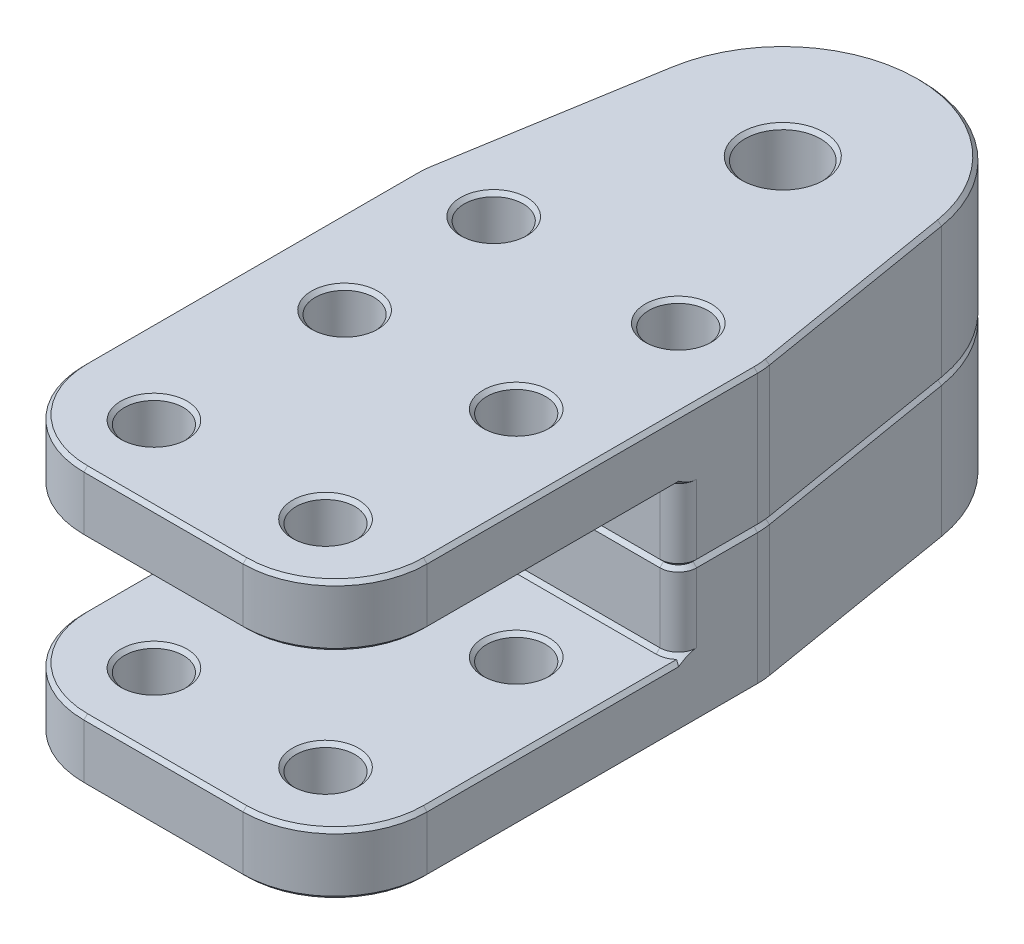
from build123d import *

# Parameters (mm, degrees)
BOSS_EXTRUDE1_DEPTH = 37.29
SKETCH2_R           = 4.1
SKETCH2_R_2         = 3.2
CUT_EXTRUDE1_DEPTH  = 61.336921532
FILLET1_R           = 10
FILLET2_R           = 2
CHAMFER1_SIZE       = 0.4
CHAMFER2_SIZE       = 0.4
CHAMFER3_SIZE       = 0.4


with BuildPart() as part:
    # Sketch1 → Boss-Extrude1 (new body)
    with BuildSketch(Plane.YZ):
        Polygon((-8.33, 0), (-8.33, 37.29), (-15, 37.29), (-15, -45), (0, -45), (0, 0), align=None)
    extrude(amount=-BOSS_EXTRUDE1_DEPTH)

    # Sketch2 → Cut-Extrude1 (cut, through all)
    with BuildSketch(Plane.XZ.offset(15)):
        with BuildLine():
            ThreePointArc((-3.848361358, -32.461602101), (-8.947681595, -41.443863673), (-18.645, -45))
            Line((-18.645, -45), (0, -45))
            Line((0, -45), (0, -8.617279713))
            ThreePointArc((0, -8.617279713), (-0.029256693, -9.32676563), (-0.116828114, -10.031433969))
            Line((-0.116828114, -10.031433969), (-3.848361358, -32.461602101))
        make_face()
        with BuildLine():
            Line((-37.29, -45), (-18.645, -45))
            ThreePointArc((-18.645, -45), (-28.342318405, -41.443863673), (-33.441638642, -32.461602101))
            Line((-33.441638642, -32.461602101), (-37.173171886, -10.031433969))
            ThreePointArc((-37.173171886, -10.031433969), (-37.260743307, -9.326765627), (-37.29, -8.617279705))
            Line((-37.29, -8.617279705), (-37.29, -45))
        make_face()
        with Locations((-18.645, -30)):
            Circle(SKETCH2_R)
        with Locations((-28.672720287, -8.617279713)):
            Circle(SKETCH2_R_2)
        with Locations((-8.617279713, -8.617279713)):
            Circle(SKETCH2_R_2)
        with Locations((-27.9675, 29.003333333)):
            Circle(SKETCH2_R_2)
        with Locations((-27.9675, 8.286666667)):
            Circle(SKETCH2_R_2)
        with Locations((-9.3225, 29.003333333)):
            Circle(SKETCH2_R_2)
        with Locations((-9.3225, 8.286666667)):
            Circle(SKETCH2_R_2)
    extrude(amount=-CUT_EXTRUDE1_DEPTH, mode=Mode.SUBTRACT)

    # Fillet1
    fillet1_edges = [part.edges().sort_by_distance(p)[0] for p in [
        (-37.29, -11.665, 37.29),
        (0, -11.665, 37.29),
    ]]
    fillet(fillet1_edges, radius=FILLET1_R)

    # Fillet2
    fillet2_edges = [part.edges().sort_by_distance(p)[0] for p in [
        (0, -4.165, 0),
        (-37.29, -4.165, 0),
    ]]
    fillet(fillet2_edges, radius=FILLET2_R)

    # Chamfer1
    chamfer1_edges = [part.edges().sort_by_distance(p)[0] for p in [
        (-31.1675, -8.33, 8.286666667),
        (-31.1675, -8.33, 29.003333333),
        (-12.5225, -8.33, 29.003333333),
        (-12.5225, -8.33, 8.286666667),
        (-11.817279713, -15, -8.617279713),
        (-31.1675, -15, 8.286666667),
        (-31.1675, -15, 29.003333333),
        (-12.5225, -15, 29.003333333),
        (-12.5225, -15, 8.286666667),
        (-22.745, -15, -30),
        (-31.872720287, -15, -8.617279713),
        (-2.928932188, -15, 34.361067812),
        (0, -15, 9.336360144),
        (-0.029256693, -15, -9.32676563),
        (-1.982594736, -15, -21.246518035),
        (-18.645, -15, -45),
        (-35.307405264, -15, -21.246518035),
        (-37.260743307, -15, -9.326765627),
        (-37.29, -15, 9.336360147),
        (-34.361067812, -15, 34.361067812),
        (-18.645, -15, 37.29),
        (-36.704213562, 0, -0.585786438),
        (-37.29, 0, -5.308639853),
        (-37.260743307, 0, -9.326765627),
        (-35.307405264, 0, -21.246518035),
        (-18.645, 0, -45),
        (-1.982594736, 0, -21.246518035),
        (-0.029256693, 0, -9.32676563),
        (0, 0, -5.308639856),
        (-0.585786438, 0, -0.585786438),
        (-18.645, 0, 0),
        (-11.817279713, 0, -8.617279713),
        (-22.745, 0, -30),
        (-31.872720287, 0, -8.617279713),
    ]]
    chamfer(chamfer1_edges, length=CHAMFER1_SIZE)

    # Chamfer2
    chamfer2_edges = [part.edges().sort_by_distance(p)[0] for p in [
        (-36.704213562, -8.33, -0.585786438),
        (-0.585786438, -8.33, -0.585786438),
        (-18.645, -8.33, 0),
    ]]
    chamfer(chamfer2_edges, length=CHAMFER2_SIZE)

    # Chamfer3
    chamfer3_edges = [part.edges().sort_by_distance(p)[0] for p in [
        (-37.29, -8.33, 13.308324958),
        (0, -8.33, 13.308324958),
        (-34.361067812, -8.33, 34.361067812),
        (-2.928932188, -8.33, 34.361067812),
        (-18.645, -8.33, 37.29),
    ]]
    chamfer(chamfer3_edges, length=CHAMFER3_SIZE)


with BuildPart() as body_2:
    # Mirror1: mirrored copy
    add(part.part.mirror(Plane(origin=(-37.29, 0, 0), x_dir=(0, 0, 1), z_dir=(0, 1, 0))))


solid = Compound([part.part, body_2.part])
